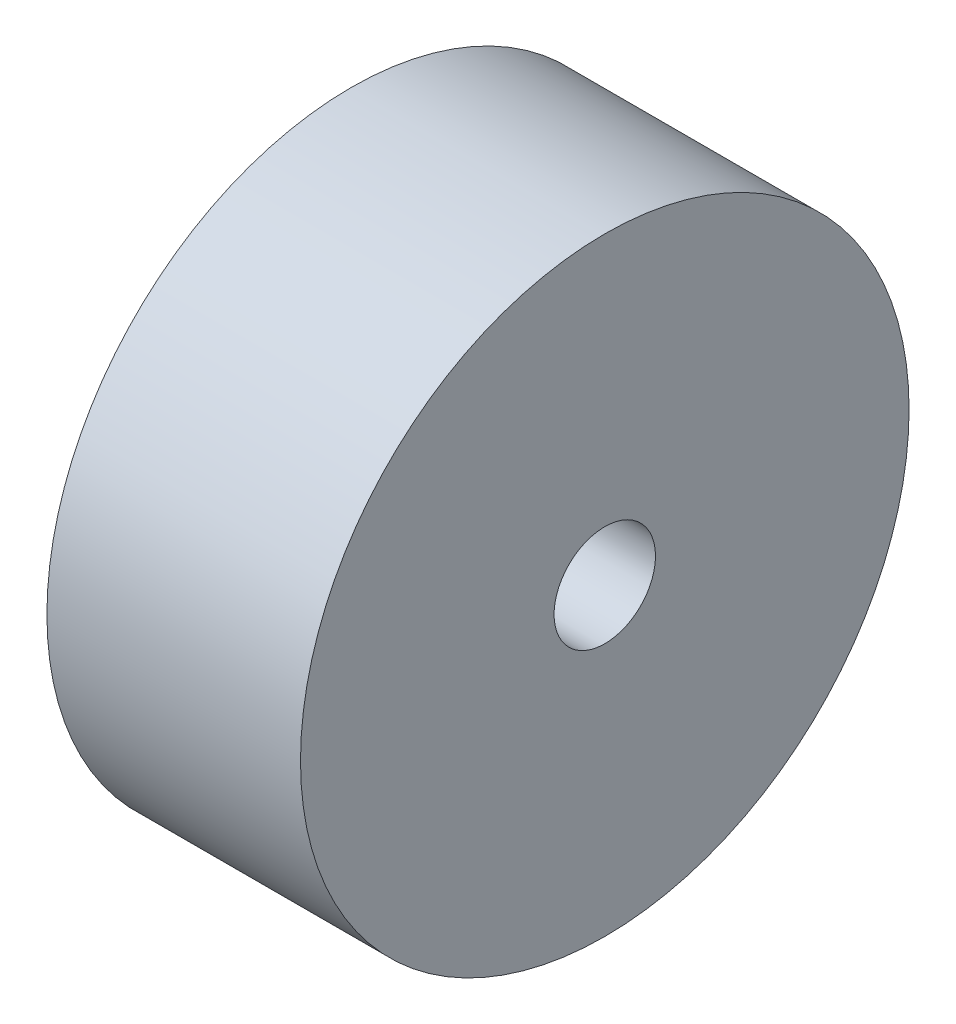
from build123d import *

# Parameters (mm, degrees)
SKETCH1_R           = 152.4
SKETCH1_R_2         = 25.4
BOSS_EXTRUDE1_DEPTH = 127


with BuildPart() as part:
    # Sketch1 → Boss-Extrude1 (new body)
    with BuildSketch(Plane(origin=(0, 0, 0), x_dir=(0, 0, -1), z_dir=(1, 0, 0))):
        Circle(SKETCH1_R)
        Circle(SKETCH1_R_2, mode=Mode.SUBTRACT)
    extrude(amount=BOSS_EXTRUDE1_DEPTH)


solid = part.part
